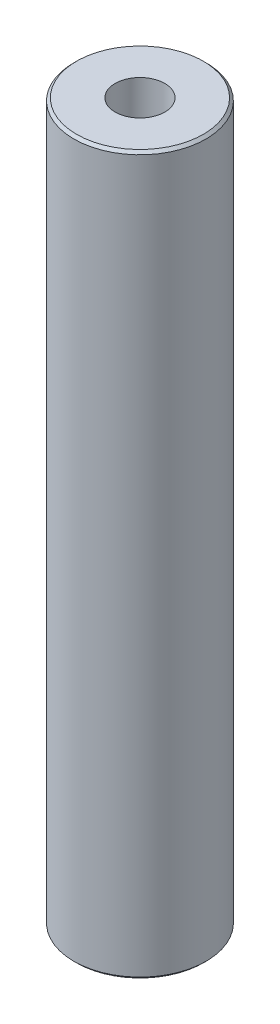
from build123d import *

# Parameters (mm, degrees)
SKETCH1_R           = 52.5
BOSS_EXTRUDE1_DEPTH = 570.047859293
SKETCH2_R           = 19.728419957
CUT_EXTRUDE1_DEPTH  = 575.862646103
CHAMFER1_SIZE       = 2.142095575


with BuildPart() as part:
    # Sketch1 → Boss-Extrude1 (new body)
    with BuildSketch(Plane(origin=(0, 0, 0), x_dir=(1, 0, 0), z_dir=(0, 1, 0))):
        Circle(SKETCH1_R)
    extrude(amount=BOSS_EXTRUDE1_DEPTH)

    # Sketch2 → Cut-Extrude1 (cut, through all)
    with BuildSketch(Plane(origin=(0, 0, 0), x_dir=(1, 0, 0), z_dir=(0, 1, 0))):
        Circle(SKETCH2_R)
    extrude(amount=CUT_EXTRUDE1_DEPTH, mode=Mode.SUBTRACT)

    # Chamfer1
    chamfer1_edges = [part.edges().sort_by_distance(p)[0] for p in [
        (-52.5, 570.047859293, 0),
        (-52.5, 0, 0),
    ]]
    chamfer(chamfer1_edges, length=CHAMFER1_SIZE)


solid = part.part
